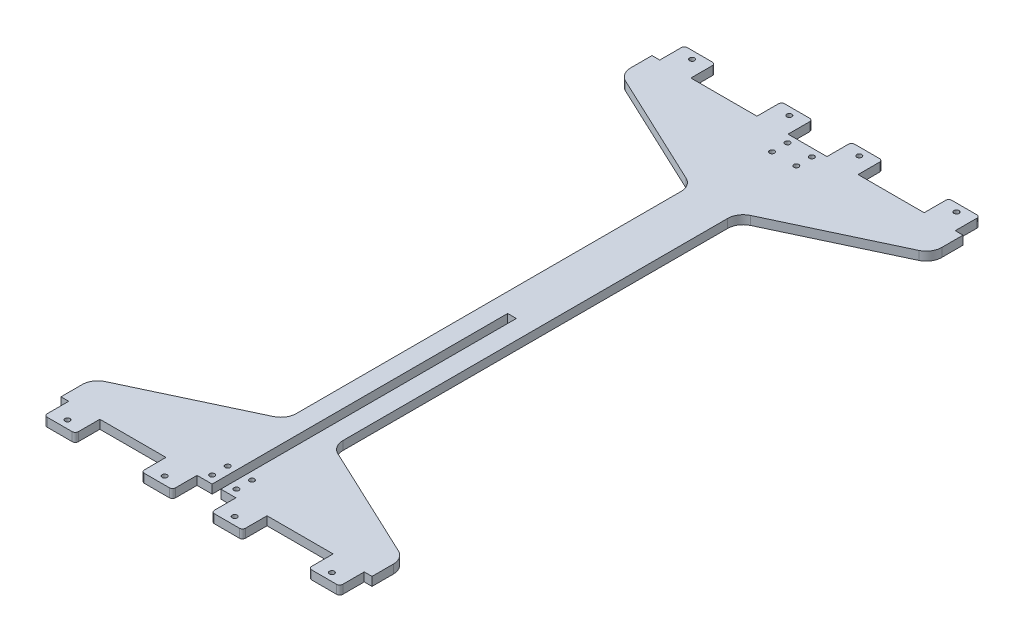
from build123d import *

# Parameters (mm, degrees)
SKETCH_1_R          = 1.6
EXTRUDE_1_DEPTH     = 5.6
CUT_EXTRUDE_1_DEPTH = 444.496335949
FILLET_1_R          = 10


with BuildPart() as part:
    # ｽｹｯﾁ1 → ﾎﾞｽ - 押し出し1 (new body)
    with BuildSketch(Plane(origin=(0, 0, 0), x_dir=(1, 0, 0), z_dir=(0, 1, 0))):
        with BuildLine():
            Line((0, 0), (5, 0))
            Line((5, 0), (5, -13.8))
            ThreePointArc((5, -13.8), (5.585786438, -15.214213562), (7, -15.8))
            Line((7, -15.8), (23, -15.8))
            ThreePointArc((23, -15.8), (24.414213562, -15.214213562), (25, -13.8))
            Line((25, -13.8), (25, 0))
            Line((25, 0), (67.5, 0))
            Line((67.5, 0), (67.5, -13.8))
            ThreePointArc((67.5, -13.8), (68.085786438, -15.214213562), (69.5, -15.8))
            Line((69.5, -15.8), (85.5, -15.8))
            ThreePointArc((85.5, -15.8), (86.914213562, -15.214213562), (87.5, -13.8))
            Line((87.5, -13.8), (87.5, 0))
            Line((87.5, 0), (97.2, 0))
            Line((97.2, 0), (97.2, 190))
            Line((97.2, 190), (102.8, 190))
            Line((102.8, 190), (102.8, 0))
            Line((102.8, 0), (112.5, 0))
            Line((112.5, 0), (112.5, -13.8))
            ThreePointArc((112.5, -13.8), (113.085786438, -15.214213562), (114.5, -15.8))
            Line((114.5, -15.8), (130.5, -15.8))
            ThreePointArc((130.5, -15.8), (131.914213562, -15.214213562), (132.5, -13.8))
            Line((132.5, -13.8), (132.5, 0))
            Line((132.5, 0), (175, 0))
            Line((175, 0), (175, -13.8))
            ThreePointArc((175, -13.8), (175.585786438, -15.214213562), (177, -15.8))
            Line((177, -15.8), (193, -15.8))
            ThreePointArc((193, -15.8), (194.414213562, -15.214213562), (195, -13.8))
            Line((195, -13.8), (195, 0))
            Line((195, 0), (200, 0))
            Line((200, 0), (200, 380))
            Line((200, 380), (195, 380))
            Line((195, 380), (195, 393.8))
            ThreePointArc((195, 393.8), (194.414213562, 395.214213562), (193, 395.8))
            Line((193, 395.8), (177, 395.8))
            ThreePointArc((177, 395.8), (175.585786438, 395.214213562), (175, 393.8))
            Line((175, 393.8), (175, 380))
            Line((175, 380), (132.5, 380))
            Line((132.5, 380), (132.5, 393.8))
            ThreePointArc((132.5, 393.8), (131.914213562, 395.214213562), (130.5, 395.8))
            Line((130.5, 395.8), (114.5, 395.8))
            ThreePointArc((114.5, 395.8), (113.085786438, 395.214213562), (112.5, 393.8))
            Line((112.5, 393.8), (112.5, 380))
            Line((112.5, 380), (87.5, 380))
            Line((87.5, 380), (87.5, 393.8))
            ThreePointArc((87.5, 393.8), (86.914213562, 395.214213562), (85.5, 395.8))
            Line((85.5, 395.8), (69.5, 395.8))
            ThreePointArc((69.5, 395.8), (68.085786438, 395.214213562), (67.5, 393.8))
            Line((67.5, 393.8), (67.5, 380))
            Line((67.5, 380), (25, 380))
            Line((25, 380), (25, 393.8))
            ThreePointArc((25, 393.8), (24.414213562, 395.214213562), (23, 395.8))
            Line((23, 395.8), (7, 395.8))
            ThreePointArc((7, 395.8), (5.585786438, 395.214213562), (5, 393.8))
            Line((5, 393.8), (5, 380))
            Line((5, 380), (0, 380))
            Line((0, 380), (0, 0))
        make_face()
        with Locations((122.5, -10.8)):
            Circle(SKETCH_1_R, mode=Mode.SUBTRACT)
        with Locations((77.5, -10.8)):
            Circle(SKETCH_1_R, mode=Mode.SUBTRACT)
        with Locations((77.5, 390.8)):
            Circle(SKETCH_1_R, mode=Mode.SUBTRACT)
        with Locations((122.5, 390.8)):
            Circle(SKETCH_1_R, mode=Mode.SUBTRACT)
        with Locations((107.8, 375)):
            Circle(SKETCH_1_R, mode=Mode.SUBTRACT)
        with Locations((92.2, 375)):
            Circle(SKETCH_1_R, mode=Mode.SUBTRACT)
        with Locations((107.8, 5)):
            Circle(SKETCH_1_R, mode=Mode.SUBTRACT)
        with Locations((92.2, 5)):
            Circle(SKETCH_1_R, mode=Mode.SUBTRACT)
        with Locations((107.8, 365)):
            Circle(SKETCH_1_R, mode=Mode.SUBTRACT)
        with Locations((92.2, 365)):
            Circle(SKETCH_1_R, mode=Mode.SUBTRACT)
        with Locations((107.8, 15)):
            Circle(SKETCH_1_R, mode=Mode.SUBTRACT)
        with Locations((92.2, 15)):
            Circle(SKETCH_1_R, mode=Mode.SUBTRACT)
        with Locations((185, -10.8)):
            Circle(SKETCH_1_R, mode=Mode.SUBTRACT)
        with Locations((185, 390.8)):
            Circle(SKETCH_1_R, mode=Mode.SUBTRACT)
        with Locations((15, -10.8)):
            Circle(SKETCH_1_R, mode=Mode.SUBTRACT)
        with Locations((15, 390.8)):
            Circle(SKETCH_1_R, mode=Mode.SUBTRACT)
    extrude(amount=EXTRUDE_1_DEPTH)

    # ｽｹｯﾁ2 → ｶｯﾄ - 押し出し1 (cut, through all)
    with BuildSketch(Plane(origin=(0, 5.6, 0), x_dir=(1, 0, 0), z_dir=(0, 1, 0))):
        Polygon((200, 20), (200, 360), (115, 320), (115, 60), align=None)
        Polygon((0, 20), (85, 60), (85, 320), (0, 360), align=None)
    extrude(amount=-CUT_EXTRUDE_1_DEPTH, mode=Mode.SUBTRACT)

    # ﾌｨﾚｯﾄ1
    fillet_1_edges = [part.edges().sort_by_distance(p)[0] for p in [
        (200, 2.8, -360),
        (115, 2.8, -320),
        (0, 2.8, -360),
        (85, 2.8, -320),
        (85, 2.8, -60),
        (0, 2.8, -20),
        (200, 2.8, -20),
        (115, 2.8, -60),
    ]]
    fillet(fillet_1_edges, radius=FILLET_1_R)


solid = part.part
